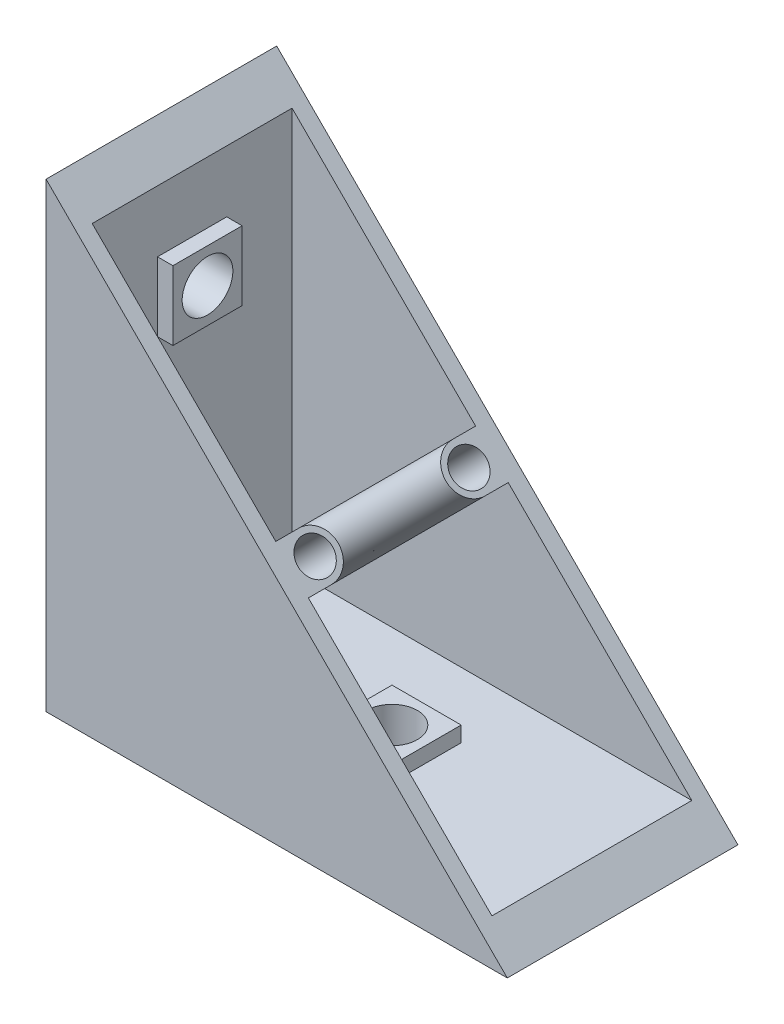
from build123d import *

# Parameters (mm, degrees)
BOSS_EXTRUDE1_DEPTH  = 30
SHELL1_START         = 4
SHELL1_OUTLINE_W     = 57
SHELL1_OUTLINE_H     = 26
SHELL1_DEPTH         = 52
SKETCH2_W            = 9
SKETCH2_H            = 9
BOSS_EXTRUDE2_DEPTH  = 2
SKETCH3_W            = 9
SKETCH3_H            = 9
BOSS_EXTRUDE3_DEPTH  = 2
BOSS_EXTRUDE4_START  = -36.769553
SKETCH4_R            = 2.25
BOSS_EXTRUDE4_DEPTH  = 36.769553
M6_CLEARANCE_HOLE2_D = 6.6
M6_CLEARANCE_HOLE3_D = 6.6


# Read off the part's stored shape, not the designer's step: Shell1
with BuildPart() as part:
    # Sketch1 → Boss-Extrude1 (new body)
    with BuildSketch(Plane.XY):
        Polygon((0, 0), (60, 0), (0, 60), align=None)
    extrude(amount=-BOSS_EXTRUDE1_DEPTH)

    # Shell1 outline → Shell1 (cut)
    with BuildSketch(Plane.YZ.offset(SHELL1_START)):
        with Locations((32.5, -15)):
            Rectangle(SHELL1_OUTLINE_W, SHELL1_OUTLINE_H)
    extrude(amount=SHELL1_DEPTH, mode=Mode.SUBTRACT)

    # Sketch2 → Boss-Extrude2 (add)
    with BuildSketch(Plane(origin=(0, 4, 0), x_dir=(1, 0, 0), z_dir=(0, 1, 0))):
        with Locations((30, 15)):
            Rectangle(SKETCH2_W, SKETCH2_H)
    extrude(amount=BOSS_EXTRUDE2_DEPTH)

    # Sketch3 → Boss-Extrude3 (add)
    with BuildSketch(Plane(origin=(4, 0, 0), x_dir=(0, 0, -1), z_dir=(1, 0, 0))):
        with Locations((15, 43.5)):
            Rectangle(SKETCH3_W, SKETCH3_H)
    extrude(amount=BOSS_EXTRUDE3_DEPTH)

    # Sketch4 → Boss-Extrude4 (add)
    # profile 1 of 2: a face of its own
    with BuildSketch(Plane(origin=(30, 30, 0), x_dir=(0, 0, -1), z_dir=(0.7071067811865477, 0.7071067811865475, 0)).offset(BOSS_EXTRUDE4_START)):
        with BuildLine():
            Line((2, 3), (2, -3))
            Line((2, -3), (5, -3))
            ThreePointArc((5, -3), (8, 0), (5, 3))
            Line((5, 3), (2, 3))
        make_face()
        with Locations(Location((5, 0, 0), (0, 0, 90))):
            Circle(SKETCH4_R, mode=Mode.SUBTRACT)
    # profile 2 of 2: a face of its own
    with BuildSketch(Plane(origin=(30, 30, 0), x_dir=(0, 0, -1), z_dir=(0.7071067811865477, 0.7071067811865475, 0)).offset(BOSS_EXTRUDE4_START)):
        with BuildLine():
            Line((25, -3), (28, -3))
            Line((28, -3), (28, 3))
            Line((28, 3), (25, 3))
            ThreePointArc((25, 3), (22, 0), (25, -3))
        make_face()
        with Locations(Location((25, 0, 0), (0, 0, 90))):
            Circle(SKETCH4_R, mode=Mode.SUBTRACT)
    extrude(amount=BOSS_EXTRUDE4_DEPTH)

    # M6 Clearance Hole2 (through all)
    with Locations(Plane(origin=(0, 6, 0), x_dir=(1, 0, 0), z_dir=(0, 1, 0))):
        with Locations((30, 15)):
            Hole(M6_CLEARANCE_HOLE2_D / 2)

    # M6 Clearance Hole3 (through all)
    with Locations(Plane(origin=(6, 0, 0), x_dir=(0, 0, -1), z_dir=(1, 0, 0))):
        with Locations((15, 43.5)):
            Hole(M6_CLEARANCE_HOLE3_D / 2)


solid = part.part
